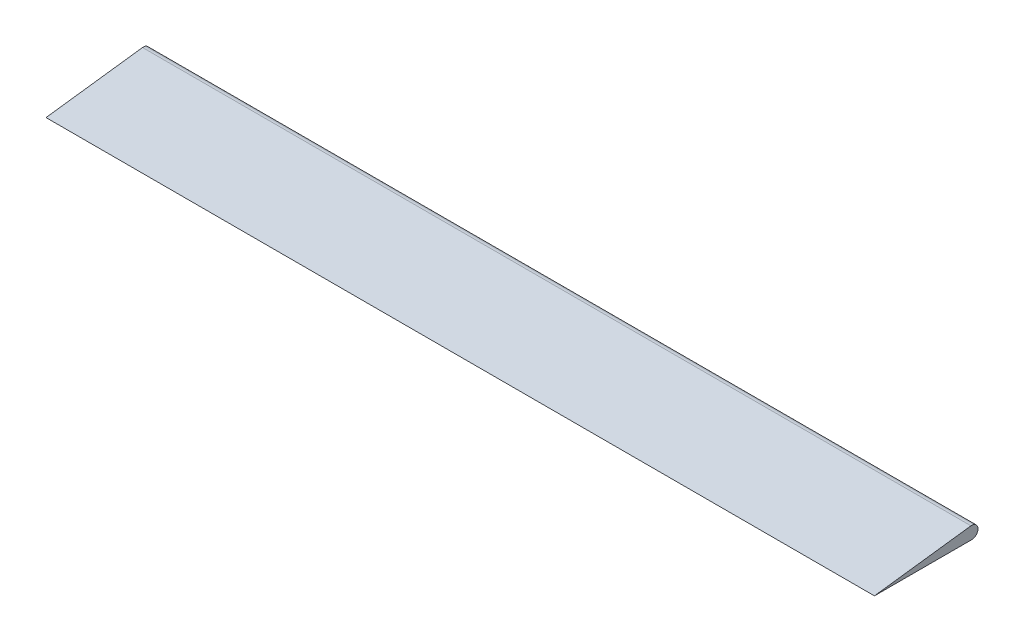
from build123d import *

# Parameters (mm, degrees)
BOSS_EXTRUDE1_DEPTH = 2000


with BuildPart() as part:
    # Sketch1 → Boss-Extrude1 (new body)
    with BuildSketch(Plane(origin=(0, 0, 0), x_dir=(0, 0, -1), z_dir=(1, 0, 0))):
        with BuildLine():
            Line((0, 0), (234.938350651, 0))
            ThreePointArc((234.938350651, 0), (249.969143719, 16.025257606), (233.015082359, 30))
            Line((233.015082359, 30), (0, 0))
        make_face()
    extrude(amount=BOSS_EXTRUDE1_DEPTH)


solid = part.part
